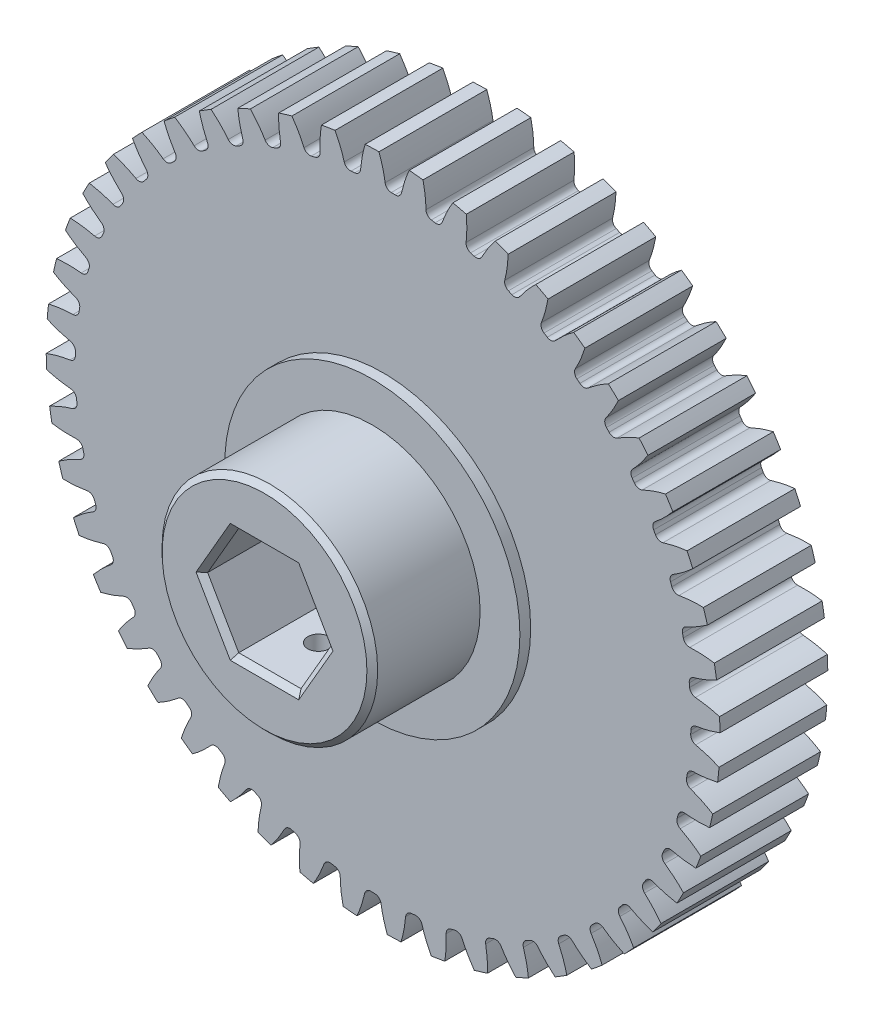
from build123d import *

# Parameters (mm, degrees)
SKETCH1_R                 = 39.6875
BOSS_EXTRUDE1_DEPTH       = 12.7
CUT_EXTRUDE1_DEPTH        = 58.545506449
FILLET1_R                 = 0.7480935
CIRPATTERN1_START         = -12.7
CIRPATTERN1_DEPTH         = 12.7
SKETCH6_R                 = 12.7
BOSS_EXTRUDE2_DEPTH       = 10.16
BOSS_EXTRUDE3_START       = 13.97
SKETCH7_R                 = 12.7
BOSS_EXTRUDE3_DEPTH       = 13.97
CUT_EXTRUDE3_DEPTH        = 12.7
M3X0_5_TAPPED_HOLE1_D     = 2.5
M3X0_5_TAPPED_HOLE1_DEPTH = 10.6700066
M3X0_5_TAPPED_HOLE1_TIP   = 0.751075774
CHAMFER1_SIZE             = 0.635
BOSS_EXTRUDE4_START       = 1.27
SKETCH11_R                = 17.3863
SKETCH11_R_2              = 12.7
BOSS_EXTRUDE4_DEPTH       = 1.27
SKETCH12_R                = 17.3863
SKETCH12_R_2              = 12.7
BOSS_EXTRUDE5_DEPTH       = 1.27
CUT_EXTRUDE4_DEPTH        = 12.7


# Read off the part's stored shape, not the designer's step: CirPattern1
with BuildPart() as part:
    # Sketch1 → Boss-Extrude1 (new body)
    with BuildSketch(Plane.XY):
        Circle(SKETCH1_R)
    extrude(amount=-BOSS_EXTRUDE1_DEPTH)

    # Sketch4 → Cut-Extrude1 (cut, through all)
    with BuildSketch(Plane.XY):
        with BuildLine():
            Line((0.240718922, 36.88563963), (0.240718922, 36.262463534))
            ThreePointArc((0.240718922, 36.262463534), (1.186503463, 36.243846604), (2.131480605, 36.20056626))
            Line((2.131480605, 36.20056626), (2.172238367, 36.822408083))
            add(Edge.make_bspline(
                [(6.893954828, 44.735686784), (3.179844428, 41.34985308), (2.172238367, 36.822408083)],
                knots=[0, 0, 0, 1, 1, 1], degree=2))
            ThreePointArc((6.893954828, 44.735686784), (1.480992288, 45.23952859), (-3.953333536, 45.090791068))
            add(Edge.make_bspline(
                [(-3.953333536, 45.090791068), (-0.468620005, 41.469291718), (0.240718922, 36.88563963)],
                knots=[0, 0, 0, 1, 1, 1], degree=2))
        make_face()
    extrude(amount=-CUT_EXTRUDE1_DEPTH, mode=Mode.SUBTRACT)

    # Fillet1
    # the kernel refuses this fillet: 0.7480935 mm, written as the material it adds along each edge
    with BuildSketch(Plane(origin=(2.131480605, 36.20056626, 0), x_dir=(-0.9988052902028769, 0.0488670877252457, 0), z_dir=(0, 0, -1))) as fillet1_piece_1:
        with BuildLine():
            CenterArc((0.727260644, 0.748056652), FILLET1_R, 189.616112264, 79.815209924)
            Line((-0.010321469, 0.623090615), (-0.025073112, 0.620591294))
            ThreePointArc((-0.025073112, 0.620591294), (-0.020120552, 0.311297499), (-0.014959818, -0.000247809))
            Line((-0.014959818, -0.000247809), (0.000148499, -0.014961133))
            ThreePointArc((0.000148499, -0.014961133), (0.359917857, -0.013175709), (0.719687215, -0.014961133))
            Line((0.719687215, -0.014961133), (0.719835714, 0))
        make_face()
    extrude(amount=12.7)
    with BuildSketch(Plane(origin=(0.240718922, 36.262463534, 0), x_dir=(0, 1, 0), z_dir=(0, 0, -1))) as fillet1_piece_2:
        with BuildLine():
            CenterArc((0.735908652, 0.739550712), FILLET1_R, 181.51769315, 79.815209924)
            Line((-0.011922412, 0.719736973), (-0.026879033, 0.719340698))
            ThreePointArc((-0.026879033, 0.719340698), (-0.019135108, 0.359650261), (-0.01496154, -9.9318e-05))
            Line((-0.01496154, -9.9318e-05), (0, -0.01496187))
            ThreePointArc((0, -0.01496187), (0.311588048, -0.01496187), (0.620921445, -0.014791014))
            Line((0.620921445, -0.014791014), (0.623176097, 0))
        make_face()
    extrude(amount=12.7)

    # CirPattern1 outline → CirPattern1 (cut)
    with BuildSketch(Plane.XY.offset(CIRPATTERN1_START)):
        with BuildLine():
            ThreePointArc((-2.112500539, 39.631237651), (-3.890052234, 39.496394138), (-5.65975547, 39.28186381))
            add(Edge.make_bspline(
                [(-5.65975547, 39.28186381), (-4.986888308, 38.00730371), (-4.57588255, 36.601497994)],
                knots=[0.684219953, 0.684219953, 0.684219953, 1, 1, 1], degree=2))
            ThreePointArc((-4.57588255, 36.601497994), (-4.274892959, 36.189054339), (-3.779406036, 36.065777368))
            ThreePointArc((-3.779406036, 36.065777368), (-3.554418528, 36.088645251), (-3.329292785, 36.110109619))
            ThreePointArc((-3.329292785, 36.110109619), (-2.867376615, 36.327682491), (-2.652634149, 36.79092128))
            add(Edge.make_bspline(
                [(-2.652634149, 36.79092128), (-2.523784618, 38.249898059), (-2.112500539, 39.631237651)],
                knots=[0, 0, 0, 0.315780047, 0.315780047, 0.315780047], degree=2))
        make_face()
        with BuildLine():
            add(Edge.make_bspline(
                [(6.959943282, 36.223853275), (7.462013348, 37.599767913), (8.216800257, 38.827591347)],
                knots=[0, 0, 0, 0.315780047, 0.315780047, 0.315780047], degree=2))
            ThreePointArc((8.216800257, 38.827591347), (6.464917097, 39.157406747), (4.699990502, 39.408219263))
            add(Edge.make_bspline(
                [(4.699990502, 39.408219263), (5.020049844, 38.002937911), (5.053201627, 36.538657746)],
                knots=[0.684219953, 0.684219953, 0.684219953, 1, 1, 1], degree=2))
            ThreePointArc((5.053201627, 36.538657746), (5.237186973, 36.062365929), (5.683884161, 35.815048066))
            ThreePointArc((5.683884161, 35.815048066), (5.90712405, 35.778905693), (6.130134206, 35.741371851))
            ThreePointArc((6.130134206, 35.741371851), (6.632622967, 35.831978404), (6.959943282, 36.223853275))
        make_face()
        with BuildLine():
            add(Edge.make_bspline(
                [(11.628561638, 35.005498294), (12.305929324, 36.304108497), (13.214522043, 37.422908271)],
                knots=[0, 0, 0, 0.315780047, 0.315780047, 0.315780047], degree=2))
            ThreePointArc((13.214522043, 37.422908271), (11.520676035, 37.978568692), (9.803586234, 38.45760462))
            add(Edge.make_bspline(
                [(9.803586234, 38.45760462), (9.9374814, 37.022569518), (9.779222651, 35.566489297)],
                knots=[0.684219953, 0.684219953, 0.684219953, 1, 1, 1], degree=2))
            ThreePointArc((9.779222651, 35.566489297), (9.89946542, 35.070257316), (10.310059592, 34.766749609))
            ThreePointArc((10.310059592, 34.766749609), (10.526672107, 34.701777786), (10.742875231, 34.635456384))
            ThreePointArc((10.742875231, 34.635456384), (11.25289166, 34.659699841), (11.628561638, 35.005498294))
        make_face()
        with BuildLine():
            add(Edge.make_bspline(
                [(16.09821208, 33.188189531), (16.939287436, 34.38727572), (17.986139693, 35.377908858)],
                knots=[0, 0, 0, 0.315780047, 0.315780047, 0.315780047], degree=2))
            ThreePointArc((17.986139693, 35.377908858), (16.379313011, 36.149906796), (14.739439888, 36.8489697))
            add(Edge.make_bspline(
                [(14.739439888, 36.8489697), (14.684879895, 35.408734696), (14.337918464, 33.985768355)],
                knots=[0.684219953, 0.684219953, 0.684219953, 1, 1, 1], degree=2))
            ThreePointArc((14.337918464, 33.985768355), (14.392361268, 33.478086876), (14.759827045, 33.123582426))
            ThreePointArc((14.759827045, 33.123582426), (14.966105885, 33.03089284), (15.171802681, 32.936918656))
            ThreePointArc((15.171802681, 32.936918656), (15.680620254, 32.894384205), (16.09821208, 33.188189531))
        make_face()
        with BuildLine():
            add(Edge.make_bspline(
                [(20.29241765, 30.803021645), (21.282809645, 31.882067121), (22.450009507, 32.727583617)],
                knots=[0, 0, 0, 0.315780047, 0.315780047, 0.315780047], degree=2))
            ThreePointArc((22.450009507, 32.727583617), (20.9576954, 33.702709973), (19.423097638, 34.609838691))
            add(Edge.make_bspline(
                [(19.423097638, 34.609838691), (19.181016023, 33.189046607), (18.651288517, 31.823541494)],
                knots=[0.684219953, 0.684219953, 0.684219953, 1, 1, 1], degree=2))
            ThreePointArc((18.651288517, 31.823541494), (18.638999825, 31.313097089), (18.957049766, 30.913661565))
            ThreePointArc((18.957049766, 30.913661565), (19.149465443, 30.794840159), (19.341136382, 30.674821118))
            ThreePointArc((19.341136382, 30.674821118), (19.84004909, 30.566236534), (20.29241765, 30.803021645))
        make_face()
        with BuildLine():
            add(Edge.make_bspline(
                [(24.139414328, 27.890805518), (25.262177079, 28.831347515), (26.529753433, 29.517280346)],
                knots=[0, 0, 0, 0.315780047, 0.315780047, 0.315780047], degree=2))
            ThreePointArc((26.529753433, 29.517280346), (25.177485811, 30.678850439), (23.774420802, 31.778523747))
            add(Edge.make_bspline(
                [(23.774420802, 31.778523747), (23.348959648, 30.401484728), (22.645529852, 29.116805014)],
                knots=[0.684219953, 0.684219953, 0.684219953, 1, 1, 1], degree=2))
            ThreePointArc((22.645529852, 29.116805014), (22.566719928, 28.612331528), (22.829912108, 28.174799383))
            ThreePointArc((22.829912108, 28.174799383), (23.005172337, 28.031879225), (23.179537876, 27.887868886))
            ThreePointArc((23.179537876, 27.887868886), (23.660009185, 27.715092082), (24.139414328, 27.890805518))
        make_face()
        with BuildLine():
            add(Edge.make_bspline(
                [(27.573378934, 24.501369976), (28.80930166, 25.287315559), (30.155565923, 25.801928224)],
                knots=[0, 0, 0, 0.315780047, 0.315780047, 0.315780047], degree=2))
            ThreePointArc((30.155565923, 25.801928224), (28.966482459, 27.130067267), (27.718957035, 28.403469451))
            add(Edge.make_bspline(
                [(27.718957035, 28.403469451), (27.117396101, 27.093745016), (26.252299893, 25.911871929)],
                knots=[0.684219953, 0.684219953, 0.684219953, 1, 1, 1], degree=2))
            ThreePointArc((26.252299893, 25.911871929), (26.108317195, 25.422001043), (26.312148326, 24.953858572))
            ThreePointArc((26.312148326, 24.953858572), (26.467254355, 24.789285066), (26.621331051, 24.623747485))
            ThreePointArc((26.621331051, 24.623747485), (27.075139963, 24.389734721), (27.573378934, 24.501369976))
        make_face()
        with BuildLine():
            add(Edge.make_bspline(
                [(30.535555382, 20.6927092), (31.863491102, 21.310610622), (33.26540832, 21.645097957)],
                knots=[0, 0, 0, 0.315780047, 0.315780047, 0.315780047], degree=2))
            ThreePointArc((33.26540832, 21.645097957), (32.25985456, 23.117081123), (31.189214228, 24.542423918))
            add(Edge.make_bspline(
                [(31.189214228, 24.542423918), (30.421846388, 23.322423816), (29.409885805, 22.26357953)],
                knots=[0.684219953, 0.684219953, 0.684219953, 1, 1, 1], degree=2))
            ThreePointArc((29.409885805, 22.26357953), (29.203193917, 21.796693071), (29.34417639, 21.305950323))
            ThreePointArc((29.34417639, 21.305950323), (29.476474312, 21.122539366), (29.607625871, 20.938306938))
            ThreePointArc((29.607625871, 20.938306938), (30.02700759, 20.647062236), (30.535555382, 20.6927092))
        make_face()
        with BuildLine():
            add(Edge.make_bspline(
                [(32.975260012, 16.529990433), (34.372487377, 16.96927523), (35.806070357, 17.117914063)],
                knots=[0, 0, 0, 0.315780047, 0.315780047, 0.315780047], degree=2))
            ThreePointArc((35.806070357, 17.117914063), (35.001251607, 18.708555312), (34.125815318, 20.261450707))
            add(Edge.make_bspline(
                [(34.125815318, 20.261450707), (33.205770449, 19.152049477), (32.064260416, 18.234351113)],
                knots=[0.684219953, 0.684219953, 0.684219953, 1, 1, 1], degree=2))
            ThreePointArc((32.064260416, 18.234351113), (31.798395894, 17.798437637), (31.87411746, 17.293491356))
            ThreePointArc((31.87411746, 17.293491356), (31.981343622, 17.094381162), (32.087326004, 16.894606154))
            ThreePointArc((32.087326004, 16.894606154), (32.465104792, 16.551112792), (32.975260012, 16.529990433))
        make_face()
        with BuildLine():
            add(Edge.make_bspline(
                [(34.8507488, 12.084438946), (36.293360863, 12.337590834), (37.734080602, 12.297837913)],
                knots=[0, 0, 0, 0.315780047, 0.315780047, 0.315780047], degree=2))
            ThreePointArc((37.734080602, 12.297837913), (37.143767534, 13.979920933), (36.478514247, 15.633798458))
            add(Edge.make_bspline(
                [(36.478514247, 15.633798458), (35.421534571, 14.653978263), (34.170006641, 13.893127893)],
                knots=[0.684219953, 0.684219953, 0.684219953, 1, 1, 1], degree=2))
            ThreePointArc((34.170006641, 13.893127893), (33.849518502, 13.495646001), (33.858683544, 12.985135958))
            ThreePointArc((33.858683544, 12.985135958), (33.939003275, 12.773733356), (34.018003092, 12.561833974))
            ThreePointArc((34.018003092, 12.561833974), (34.34771505, 12.171969219), (34.8507488, 12.084438946))
        make_face()
        with BuildLine():
            add(Edge.make_bspline(
                [(36.129931613, 7.432119359), (37.593244882, 7.494806837), (39.016450267, 7.267342347)],
                knots=[0, 0, 0, 0.315780047, 0.315780047, 0.315780047], degree=2))
            ThreePointArc((39.016450267, 7.267342347), (38.6507433, 9.01208623), (38.207055683, 10.738647582))
            add(Edge.make_bspline(
                [(38.207055683, 10.738647582), (37.031226416, 9.905173417), (35.69109458, 9.314189403)],
                knots=[0.684219953, 0.684219953, 0.684219953, 1, 1, 1], degree=2))
            ThreePointArc((35.69109458, 9.314189403), (35.321466463, 8.96194012), (35.263918164, 8.454601283))
            ThreePointArc((35.263918164, 8.454601283), (35.315957172, 8.234523431), (35.366622715, 8.014125333))
            ThreePointArc((35.366622715, 8.014125333), (35.642626379, 7.584559878), (36.129931613, 7.432119359))
        make_face()
        with BuildLine():
            add(Edge.make_bspline(
                [(36.79092128, 2.652634149), (38.249898059, 2.523784618), (39.631237651, 2.112500539)],
                knots=[0, 0, 0, 0.315780047, 0.315780047, 0.315780047], degree=2))
            ThreePointArc((39.631237651, 2.112500539), (39.496394132, 3.890052234), (39.281863803, 5.659755469))
            add(Edge.make_bspline(
                [(39.281863803, 5.659755469), (38.00730371, 4.986888308), (36.601497994, 4.57588255)],
                knots=[0.684219953, 0.684219953, 0.684219953, 1, 1, 1], degree=2))
            ThreePointArc((36.601497994, 4.57588255), (36.189054339, 4.274892959), (36.065777368, 3.779406036))
            ThreePointArc((36.065777368, 3.779406036), (36.088645251, 3.554418528), (36.110109619, 3.329292785))
            ThreePointArc((36.110109619, 3.329292785), (36.327682491, 2.867376615), (36.79092128, 2.652634149))
        make_face()
        with BuildLine():
            add(Edge.make_bspline(
                [(36.822408083, -2.172238367), (38.252084875, -2.490420255), (39.56792357, -3.07848674)],
                knots=[0, 0, 0, 0.315780047, 0.315780047, 0.315780047], degree=2))
            ThreePointArc((39.56792357, -3.07848674), (39.666250711, -1.298541635), (39.684548343, 0.484023371))
            add(Edge.make_bspline(
                [(39.684548343, 0.484023371), (38.3330655, -0.016723843), (36.88563963, -0.240718922)],
                knots=[0.684219953, 0.684219953, 0.684219953, 1, 1, 1], degree=2))
            ThreePointArc((36.88563963, -0.240718922), (36.437437463, -0.485298806), (36.250541122, -0.960455895))
            ThreePointArc((36.250541122, -0.960455895), (36.243846604, -1.186503463), (36.235742535, -1.412504886))
            ThreePointArc((36.235742535, -1.412504886), (36.391161882, -1.898868257), (36.822408083, -2.172238367))
        make_face()
        with BuildLine():
            add(Edge.make_bspline(
                [(36.223853275, -6.959943282), (37.599767913, -7.462013348), (38.827591347, -8.216800257)],
                knots=[0, 0, 0, 0.315780047, 0.315780047, 0.315780047], degree=2))
            ThreePointArc((38.827591347, -8.216800257), (39.157406742, -6.464917096), (39.408219258, -4.699990501))
            add(Edge.make_bspline(
                [(39.408219258, -4.699990501), (38.002937911, -5.020049844), (36.538657746, -5.053201627)],
                knots=[0.684219953, 0.684219953, 0.684219953, 1, 1, 1], degree=2))
            ThreePointArc((36.538657746, -5.053201627), (36.062365929, -5.237186973), (35.815048066, -5.683884161))
            ThreePointArc((35.815048066, -5.683884161), (35.778905693, -5.90712405), (35.741371851, -6.130134206))
            ThreePointArc((35.741371851, -6.130134206), (35.831978404, -6.632622967), (36.223853275, -6.959943282))
        make_face()
        with BuildLine():
            add(Edge.make_bspline(
                [(35.005498294, -11.628561638), (36.304108497, -12.305929324), (37.422908271, -13.214522043)],
                knots=[0, 0, 0, 0.315780047, 0.315780047, 0.315780047], degree=2))
            ThreePointArc((37.422908271, -13.214522043), (37.978568688, -11.520676033), (38.457604616, -9.803586233))
            add(Edge.make_bspline(
                [(38.457604616, -9.803586233), (37.022569518, -9.9374814), (35.566489297, -9.779222651)],
                knots=[0.684219953, 0.684219953, 0.684219953, 1, 1, 1], degree=2))
            ThreePointArc((35.566489297, -9.779222651), (35.070257316, -9.89946542), (34.766749609, -10.310059592))
            ThreePointArc((34.766749609, -10.310059592), (34.701777786, -10.526672107), (34.635456384, -10.742875231))
            ThreePointArc((34.635456384, -10.742875231), (34.659699841, -11.25289166), (35.005498294, -11.628561638))
        make_face()
        with BuildLine():
            add(Edge.make_bspline(
                [(33.188189531, -16.09821208), (34.38727572, -16.939287436), (35.377908858, -17.986139693)],
                knots=[0, 0, 0, 0.315780047, 0.315780047, 0.315780047], degree=2))
            ThreePointArc((35.377908858, -17.986139693), (36.149906794, -16.37931301), (36.848969696, -14.739439886))
            add(Edge.make_bspline(
                [(36.848969696, -14.739439886), (35.408734696, -14.684879895), (33.985768355, -14.337918464)],
                knots=[0.684219953, 0.684219953, 0.684219953, 1, 1, 1], degree=2))
            ThreePointArc((33.985768355, -14.337918464), (33.478086876, -14.392361268), (33.123582426, -14.759827045))
            ThreePointArc((33.123582426, -14.759827045), (33.03089284, -14.966105885), (32.936918656, -15.171802681))
            ThreePointArc((32.936918656, -15.171802681), (32.894384205, -15.680620254), (33.188189531, -16.09821208))
        make_face()
        with BuildLine():
            add(Edge.make_bspline(
                [(30.803021645, -20.29241765), (31.882067121, -21.282809645), (32.727583617, -22.450009507)],
                knots=[0, 0, 0, 0.315780047, 0.315780047, 0.315780047], degree=2))
            ThreePointArc((32.727583617, -22.450009507), (33.702709972, -20.957695399), (34.609838689, -19.423097637))
            add(Edge.make_bspline(
                [(34.609838689, -19.423097637), (33.189046607, -19.181016023), (31.823541494, -18.651288517)],
                knots=[0.684219953, 0.684219953, 0.684219953, 1, 1, 1], degree=2))
            ThreePointArc((31.823541494, -18.651288517), (31.313097089, -18.638999825), (30.913661565, -18.957049766))
            ThreePointArc((30.913661565, -18.957049766), (30.794840159, -19.149465443), (30.674821118, -19.341136382))
            ThreePointArc((30.674821118, -19.341136382), (30.566236534, -19.84004909), (30.803021645, -20.29241765))
        make_face()
        with BuildLine():
            add(Edge.make_bspline(
                [(27.890805518, -24.139414328), (28.831347515, -25.262177079), (29.517280346, -26.529753433)],
                knots=[0, 0, 0, 0.315780047, 0.315780047, 0.315780047], degree=2))
            ThreePointArc((29.517280346, -26.529753433), (30.678850438, -25.17748581), (31.778523746, -23.774420801))
            add(Edge.make_bspline(
                [(31.778523746, -23.774420801), (30.401484728, -23.348959648), (29.116805014, -22.645529852)],
                knots=[0.684219953, 0.684219953, 0.684219953, 1, 1, 1], degree=2))
            ThreePointArc((29.116805014, -22.645529852), (28.612331528, -22.566719928), (28.174799383, -22.829912108))
            ThreePointArc((28.174799383, -22.829912108), (28.031879225, -23.005172337), (27.887868886, -23.179537876))
            ThreePointArc((27.887868886, -23.179537876), (27.715092082, -23.660009185), (27.890805518, -24.139414328))
        make_face()
        with BuildLine():
            add(Edge.make_bspline(
                [(24.501369976, -27.573378934), (25.287315559, -28.80930166), (25.801928224, -30.155565923)],
                knots=[0, 0, 0, 0.315780047, 0.315780047, 0.315780047], degree=2))
            ThreePointArc((25.801928224, -30.155565923), (27.130067267, -28.966482459), (28.403469451, -27.718957035))
            add(Edge.make_bspline(
                [(28.403469451, -27.718957035), (27.093745016, -27.117396101), (25.911871929, -26.252299893)],
                knots=[0.684219953, 0.684219953, 0.684219953, 1, 1, 1], degree=2))
            ThreePointArc((25.911871929, -26.252299893), (25.422001043, -26.108317195), (24.953858572, -26.312148326))
            ThreePointArc((24.953858572, -26.312148326), (24.789285066, -26.467254355), (24.623747485, -26.621331051))
            ThreePointArc((24.623747485, -26.621331051), (24.389734721, -27.075139963), (24.501369976, -27.573378934))
        make_face()
        with BuildLine():
            add(Edge.make_bspline(
                [(20.6927092, -30.535555382), (21.310610622, -31.863491102), (21.645097957, -33.26540832)],
                knots=[0, 0, 0, 0.315780047, 0.315780047, 0.315780047], degree=2))
            ThreePointArc((21.645097957, -33.26540832), (23.117081124, -32.259854561), (24.542423918, -31.189214229))
            add(Edge.make_bspline(
                [(24.542423918, -31.189214229), (23.322423816, -30.421846388), (22.26357953, -29.409885805)],
                knots=[0.684219953, 0.684219953, 0.684219953, 1, 1, 1], degree=2))
            ThreePointArc((22.26357953, -29.409885805), (21.796693071, -29.203193917), (21.305950323, -29.34417639))
            ThreePointArc((21.305950323, -29.34417639), (21.122539366, -29.476474312), (20.938306938, -29.607625871))
            ThreePointArc((20.938306938, -29.607625871), (20.647062236, -30.02700759), (20.6927092, -30.535555382))
        make_face()
        with BuildLine():
            add(Edge.make_bspline(
                [(16.529990433, -32.975260012), (16.96927523, -34.372487377), (17.117914063, -35.806070357)],
                knots=[0, 0, 0, 0.315780047, 0.315780047, 0.315780047], degree=2))
            ThreePointArc((17.117914063, -35.806070357), (18.708555313, -35.001251608), (20.261450708, -34.12581532))
            add(Edge.make_bspline(
                [(20.261450708, -34.12581532), (19.152049477, -33.205770449), (18.234351113, -32.064260416)],
                knots=[0.684219953, 0.684219953, 0.684219953, 1, 1, 1], degree=2))
            ThreePointArc((18.234351113, -32.064260416), (17.798437637, -31.798395894), (17.293491356, -31.87411746))
            ThreePointArc((17.293491356, -31.87411746), (17.094381162, -31.981343622), (16.894606154, -32.087326004))
            ThreePointArc((16.894606154, -32.087326004), (16.551112792, -32.465104792), (16.529990433, -32.975260012))
        make_face()
        with BuildLine():
            add(Edge.make_bspline(
                [(12.084438946, -34.8507488), (12.337590834, -36.293360863), (12.297837913, -37.734080602)],
                knots=[0, 0, 0, 0.315780047, 0.315780047, 0.315780047], degree=2))
            ThreePointArc((12.297837913, -37.734080602), (13.979920934, -37.143767536), (15.633798459, -36.478514249))
            add(Edge.make_bspline(
                [(15.633798459, -36.478514249), (14.653978263, -35.421534571), (13.893127893, -34.170006641)],
                knots=[0.684219953, 0.684219953, 0.684219953, 1, 1, 1], degree=2))
            ThreePointArc((13.893127893, -34.170006641), (13.495646001, -33.849518502), (12.985135958, -33.858683544))
            ThreePointArc((12.985135958, -33.858683544), (12.773733356, -33.939003275), (12.561833974, -34.018003092))
            ThreePointArc((12.561833974, -34.018003092), (12.171969219, -34.34771505), (12.084438946, -34.8507488))
        make_face()
        with BuildLine():
            add(Edge.make_bspline(
                [(7.432119359, -36.129931613), (7.494806837, -37.593244882), (7.267342347, -39.016450267)],
                knots=[0, 0, 0, 0.315780047, 0.315780047, 0.315780047], degree=2))
            ThreePointArc((7.267342347, -39.016450267), (9.012086231, -38.650743303), (10.738647583, -38.207055686))
            add(Edge.make_bspline(
                [(10.738647583, -38.207055686), (9.905173417, -37.031226416), (9.314189403, -35.69109458)],
                knots=[0.684219953, 0.684219953, 0.684219953, 1, 1, 1], degree=2))
            ThreePointArc((9.314189403, -35.69109458), (8.96194012, -35.321466463), (8.454601283, -35.263918164))
            ThreePointArc((8.454601283, -35.263918164), (8.234523431, -35.315957172), (8.014125333, -35.366622715))
            ThreePointArc((8.014125333, -35.366622715), (7.584559878, -35.642626379), (7.432119359, -36.129931613))
        make_face()
        with BuildLine():
            add(Edge.make_bspline(
                [(2.652634149, -36.79092128), (2.523784618, -38.249898059), (2.112500539, -39.631237651)],
                knots=[0, 0, 0, 0.315780047, 0.315780047, 0.315780047], degree=2))
            ThreePointArc((2.112500539, -39.631237651), (3.890052234, -39.496394137), (5.65975547, -39.281863808))
            add(Edge.make_bspline(
                [(5.65975547, -39.281863808), (4.986888308, -38.00730371), (4.57588255, -36.601497994)],
                knots=[0.684219953, 0.684219953, 0.684219953, 1, 1, 1], degree=2))
            ThreePointArc((4.57588255, -36.601497994), (4.274892959, -36.189054339), (3.779406036, -36.065777368))
            ThreePointArc((3.779406036, -36.065777368), (3.554418528, -36.088645251), (3.329292785, -36.110109619))
            ThreePointArc((3.329292785, -36.110109619), (2.867376615, -36.327682491), (2.652634149, -36.79092128))
        make_face()
        with BuildLine():
            add(Edge.make_bspline(
                [(-2.172238367, -36.822408083), (-2.490420255, -38.252084875), (-3.07848674, -39.56792357)],
                knots=[0, 0, 0, 0.315780047, 0.315780047, 0.315780047], degree=2))
            ThreePointArc((-3.07848674, -39.56792357), (-1.298541635, -39.666250716), (0.484023371, -39.684548348))
            add(Edge.make_bspline(
                [(0.484023371, -39.684548348), (-0.016723843, -38.3330655), (-0.240718922, -36.88563963)],
                knots=[0.684219953, 0.684219953, 0.684219953, 1, 1, 1], degree=2))
            ThreePointArc((-0.240718922, -36.88563963), (-0.485298806, -36.437437463), (-0.960455895, -36.250541122))
            ThreePointArc((-0.960455895, -36.250541122), (-1.186503463, -36.243846604), (-1.412504886, -36.235742535))
            ThreePointArc((-1.412504886, -36.235742535), (-1.898868257, -36.391161882), (-2.172238367, -36.822408083))
        make_face()
        with BuildLine():
            add(Edge.make_bspline(
                [(-6.959943282, -36.223853275), (-7.462013348, -37.599767913), (-8.216800257, -38.827591347)],
                knots=[0, 0, 0, 0.315780047, 0.315780047, 0.315780047], degree=2))
            ThreePointArc((-8.216800257, -38.827591347), (-6.464917097, -39.157406748), (-4.699990502, -39.408219264))
            add(Edge.make_bspline(
                [(-4.699990502, -39.408219264), (-5.020049844, -38.002937911), (-5.053201627, -36.538657746)],
                knots=[0.684219953, 0.684219953, 0.684219953, 1, 1, 1], degree=2))
            ThreePointArc((-5.053201627, -36.538657746), (-5.237186973, -36.062365929), (-5.683884161, -35.815048066))
            ThreePointArc((-5.683884161, -35.815048066), (-5.90712405, -35.778905693), (-6.130134206, -35.741371851))
            ThreePointArc((-6.130134206, -35.741371851), (-6.632622967, -35.831978404), (-6.959943282, -36.223853275))
        make_face()
        with BuildLine():
            add(Edge.make_bspline(
                [(-11.628561638, -35.005498294), (-12.305929324, -36.304108497), (-13.214522043, -37.422908271)],
                knots=[0, 0, 0, 0.315780047, 0.315780047, 0.315780047], degree=2))
            ThreePointArc((-13.214522043, -37.422908271), (-11.520676035, -37.978568694), (-9.803586235, -38.457604622))
            add(Edge.make_bspline(
                [(-9.803586235, -38.457604622), (-9.9374814, -37.022569518), (-9.779222651, -35.566489297)],
                knots=[0.684219953, 0.684219953, 0.684219953, 1, 1, 1], degree=2))
            ThreePointArc((-9.779222651, -35.566489297), (-9.89946542, -35.070257316), (-10.310059592, -34.766749609))
            ThreePointArc((-10.310059592, -34.766749609), (-10.526672107, -34.701777786), (-10.742875231, -34.635456384))
            ThreePointArc((-10.742875231, -34.635456384), (-11.25289166, -34.659699841), (-11.628561638, -35.005498294))
        make_face()
        with BuildLine():
            add(Edge.make_bspline(
                [(-16.09821208, -33.188189531), (-16.939287436, -34.38727572), (-17.986139693, -35.377908858)],
                knots=[0, 0, 0, 0.315780047, 0.315780047, 0.315780047], degree=2))
            ThreePointArc((-17.986139693, -35.377908858), (-16.379313013, -36.1499068), (-14.739439889, -36.848969703))
            add(Edge.make_bspline(
                [(-14.739439889, -36.848969703), (-14.684879895, -35.408734696), (-14.337918464, -33.985768355)],
                knots=[0.684219953, 0.684219953, 0.684219953, 1, 1, 1], degree=2))
            ThreePointArc((-14.337918464, -33.985768355), (-14.392361268, -33.478086876), (-14.759827045, -33.123582426))
            ThreePointArc((-14.759827045, -33.123582426), (-14.966105885, -33.03089284), (-15.171802681, -32.936918656))
            ThreePointArc((-15.171802681, -32.936918656), (-15.680620254, -32.894384205), (-16.09821208, -33.188189531))
        make_face()
        with BuildLine():
            add(Edge.make_bspline(
                [(-20.29241765, -30.803021645), (-21.282809645, -31.882067121), (-22.450009507, -32.727583617)],
                knots=[0, 0, 0, 0.315780047, 0.315780047, 0.315780047], degree=2))
            ThreePointArc((-22.450009507, -32.727583617), (-20.957695403, -33.702709978), (-19.42309764, -34.609838695))
            add(Edge.make_bspline(
                [(-19.42309764, -34.609838695), (-19.181016023, -33.189046607), (-18.651288517, -31.823541494)],
                knots=[0.684219953, 0.684219953, 0.684219953, 1, 1, 1], degree=2))
            ThreePointArc((-18.651288517, -31.823541494), (-18.638999825, -31.313097089), (-18.957049766, -30.913661565))
            ThreePointArc((-18.957049766, -30.913661565), (-19.149465443, -30.794840159), (-19.341136382, -30.674821118))
            ThreePointArc((-19.341136382, -30.674821118), (-19.84004909, -30.566236534), (-20.29241765, -30.803021645))
        make_face()
        with BuildLine():
            add(Edge.make_bspline(
                [(-24.139414328, -27.890805518), (-25.262177079, -28.831347515), (-26.529753433, -29.517280346)],
                knots=[0, 0, 0, 0.315780047, 0.315780047, 0.315780047], degree=2))
            ThreePointArc((-26.529753433, -29.517280346), (-25.177485815, -30.678850444), (-23.774420806, -31.778523752))
            add(Edge.make_bspline(
                [(-23.774420806, -31.778523752), (-23.348959648, -30.401484728), (-22.645529852, -29.116805014)],
                knots=[0.684219953, 0.684219953, 0.684219953, 1, 1, 1], degree=2))
            ThreePointArc((-22.645529852, -29.116805014), (-22.566719928, -28.612331528), (-22.829912108, -28.174799383))
            ThreePointArc((-22.829912108, -28.174799383), (-23.005172337, -28.031879225), (-23.179537876, -27.887868886))
            ThreePointArc((-23.179537876, -27.887868886), (-23.660009185, -27.715092082), (-24.139414328, -27.890805518))
        make_face()
        with BuildLine():
            add(Edge.make_bspline(
                [(-27.573378934, -24.501369976), (-28.80930166, -25.287315559), (-30.155565923, -25.801928224)],
                knots=[0, 0, 0, 0.315780047, 0.315780047, 0.315780047], degree=2))
            ThreePointArc((-30.155565923, -25.801928224), (-28.966482464, -27.130067272), (-27.71895704, -28.403469456))
            add(Edge.make_bspline(
                [(-27.71895704, -28.403469456), (-27.117396101, -27.093745016), (-26.252299893, -25.911871929)],
                knots=[0.684219953, 0.684219953, 0.684219953, 1, 1, 1], degree=2))
            ThreePointArc((-26.252299893, -25.911871929), (-26.108317195, -25.422001043), (-26.312148326, -24.953858572))
            ThreePointArc((-26.312148326, -24.953858572), (-26.467254355, -24.789285066), (-26.621331051, -24.623747485))
            ThreePointArc((-26.621331051, -24.623747485), (-27.075139963, -24.389734721), (-27.573378934, -24.501369976))
        make_face()
        with BuildLine():
            add(Edge.make_bspline(
                [(-30.535555382, -20.6927092), (-31.863491102, -21.310610622), (-33.26540832, -21.645097957)],
                knots=[0, 0, 0, 0.315780047, 0.315780047, 0.315780047], degree=2))
            ThreePointArc((-33.26540832, -21.645097957), (-32.259854567, -23.117081128), (-31.189214234, -24.542423923))
            add(Edge.make_bspline(
                [(-31.189214234, -24.542423923), (-30.421846388, -23.322423816), (-29.409885805, -22.26357953)],
                knots=[0.684219953, 0.684219953, 0.684219953, 1, 1, 1], degree=2))
            ThreePointArc((-29.409885805, -22.26357953), (-29.203193917, -21.796693071), (-29.34417639, -21.305950323))
            ThreePointArc((-29.34417639, -21.305950323), (-29.476474312, -21.122539366), (-29.607625871, -20.938306938))
            ThreePointArc((-29.607625871, -20.938306938), (-30.02700759, -20.647062236), (-30.535555382, -20.6927092))
        make_face()
        with BuildLine():
            add(Edge.make_bspline(
                [(-32.975260012, -16.529990433), (-34.372487377, -16.96927523), (-35.806070357, -17.117914063)],
                knots=[0, 0, 0, 0.315780047, 0.315780047, 0.315780047], degree=2))
            ThreePointArc((-35.806070357, -17.117914063), (-35.001251615, -18.708555316), (-34.125815326, -20.261450712))
            add(Edge.make_bspline(
                [(-34.125815326, -20.261450712), (-33.205770449, -19.152049477), (-32.064260416, -18.234351113)],
                knots=[0.684219953, 0.684219953, 0.684219953, 1, 1, 1], degree=2))
            ThreePointArc((-32.064260416, -18.234351113), (-31.798395894, -17.798437637), (-31.87411746, -17.293491356))
            ThreePointArc((-31.87411746, -17.293491356), (-31.981343622, -17.094381162), (-32.087326004, -16.894606154))
            ThreePointArc((-32.087326004, -16.894606154), (-32.465104792, -16.551112792), (-32.975260012, -16.529990433))
        make_face()
        with BuildLine():
            add(Edge.make_bspline(
                [(-34.8507488, -12.084438946), (-36.293360863, -12.337590834), (-37.734080602, -12.297837913)],
                knots=[0, 0, 0, 0.315780047, 0.315780047, 0.315780047], degree=2))
            ThreePointArc((-37.734080602, -12.297837913), (-37.143767543, -13.979920936), (-36.478514256, -15.633798461))
            add(Edge.make_bspline(
                [(-36.478514256, -15.633798461), (-35.421534571, -14.653978263), (-34.170006641, -13.893127893)],
                knots=[0.684219953, 0.684219953, 0.684219953, 1, 1, 1], degree=2))
            ThreePointArc((-34.170006641, -13.893127893), (-33.849518502, -13.495646001), (-33.858683544, -12.985135958))
            ThreePointArc((-33.858683544, -12.985135958), (-33.939003275, -12.773733356), (-34.018003092, -12.561833974))
            ThreePointArc((-34.018003092, -12.561833974), (-34.34771505, -12.171969219), (-34.8507488, -12.084438946))
        make_face()
        with BuildLine():
            add(Edge.make_bspline(
                [(-36.129931613, -7.432119359), (-37.593244882, -7.494806837), (-39.016450267, -7.267342347)],
                knots=[0, 0, 0, 0.315780047, 0.315780047, 0.315780047], degree=2))
            ThreePointArc((-39.016450267, -7.267342347), (-38.65074331, -9.012086233), (-38.207055693, -10.738647585))
            add(Edge.make_bspline(
                [(-38.207055693, -10.738647585), (-37.031226416, -9.905173417), (-35.69109458, -9.314189403)],
                knots=[0.684219953, 0.684219953, 0.684219953, 1, 1, 1], degree=2))
            ThreePointArc((-35.69109458, -9.314189403), (-35.321466463, -8.96194012), (-35.263918164, -8.454601283))
            ThreePointArc((-35.263918164, -8.454601283), (-35.315957172, -8.234523431), (-35.366622715, -8.014125333))
            ThreePointArc((-35.366622715, -8.014125333), (-35.642626379, -7.584559878), (-36.129931613, -7.432119359))
        make_face()
        with BuildLine():
            add(Edge.make_bspline(
                [(-36.79092128, -2.652634149), (-38.249898059, -2.523784618), (-39.631237651, -2.112500539)],
                knots=[0, 0, 0, 0.315780047, 0.315780047, 0.315780047], degree=2))
            ThreePointArc((-39.631237651, -2.112500539), (-39.496394143, -3.890052235), (-39.281863814, -5.659755471))
            add(Edge.make_bspline(
                [(-39.281863814, -5.659755471), (-38.00730371, -4.986888308), (-36.601497994, -4.57588255)],
                knots=[0.684219953, 0.684219953, 0.684219953, 1, 1, 1], degree=2))
            ThreePointArc((-36.601497994, -4.57588255), (-36.189054339, -4.274892959), (-36.065777368, -3.779406036))
            ThreePointArc((-36.065777368, -3.779406036), (-36.088645251, -3.554418528), (-36.110109619, -3.329292785))
            ThreePointArc((-36.110109619, -3.329292785), (-36.327682491, -2.867376615), (-36.79092128, -2.652634149))
        make_face()
        with BuildLine():
            add(Edge.make_bspline(
                [(-36.822408083, 2.172238367), (-38.252084875, 2.490420255), (-39.56792357, 3.07848674)],
                knots=[0, 0, 0, 0.315780047, 0.315780047, 0.315780047], degree=2))
            ThreePointArc((-39.56792357, 3.07848674), (-39.666250722, 1.298541635), (-39.684548354, -0.484023371))
            add(Edge.make_bspline(
                [(-39.684548354, -0.484023371), (-38.3330655, 0.016723843), (-36.88563963, 0.240718922)],
                knots=[0.684219953, 0.684219953, 0.684219953, 1, 1, 1], degree=2))
            ThreePointArc((-36.88563963, 0.240718922), (-36.437437463, 0.485298806), (-36.250541122, 0.960455895))
            ThreePointArc((-36.250541122, 0.960455895), (-36.243846604, 1.186503463), (-36.235742535, 1.412504886))
            ThreePointArc((-36.235742535, 1.412504886), (-36.391161882, 1.898868257), (-36.822408083, 2.172238367))
        make_face()
        with BuildLine():
            add(Edge.make_bspline(
                [(-36.223853275, 6.959943282), (-37.599767913, 7.462013348), (-38.827591347, 8.216800257)],
                knots=[0, 0, 0, 0.315780047, 0.315780047, 0.315780047], degree=2))
            ThreePointArc((-38.827591347, 8.216800257), (-39.157406753, 6.464917098), (-39.408219269, 4.699990503))
            add(Edge.make_bspline(
                [(-39.408219269, 4.699990503), (-38.002937911, 5.020049844), (-36.538657746, 5.053201627)],
                knots=[0.684219953, 0.684219953, 0.684219953, 1, 1, 1], degree=2))
            ThreePointArc((-36.538657746, 5.053201627), (-36.062365929, 5.237186973), (-35.815048066, 5.683884161))
            ThreePointArc((-35.815048066, 5.683884161), (-35.778905693, 5.90712405), (-35.741371851, 6.130134206))
            ThreePointArc((-35.741371851, 6.130134206), (-35.831978404, 6.632622967), (-36.223853275, 6.959943282))
        make_face()
        with BuildLine():
            add(Edge.make_bspline(
                [(-35.005498294, 11.628561638), (-36.304108497, 12.305929324), (-37.422908271, 13.214522043)],
                knots=[0, 0, 0, 0.315780047, 0.315780047, 0.315780047], degree=2))
            ThreePointArc((-37.422908271, 13.214522043), (-37.978568698, 11.520676036), (-38.457604626, 9.803586236))
            add(Edge.make_bspline(
                [(-38.457604626, 9.803586236), (-37.022569518, 9.9374814), (-35.566489297, 9.779222651)],
                knots=[0.684219953, 0.684219953, 0.684219953, 1, 1, 1], degree=2))
            ThreePointArc((-35.566489297, 9.779222651), (-35.070257316, 9.89946542), (-34.766749609, 10.310059592))
            ThreePointArc((-34.766749609, 10.310059592), (-34.701777786, 10.526672107), (-34.635456384, 10.742875231))
            ThreePointArc((-34.635456384, 10.742875231), (-34.659699841, 11.25289166), (-35.005498294, 11.628561638))
        make_face()
        with BuildLine():
            add(Edge.make_bspline(
                [(-33.188189531, 16.09821208), (-34.38727572, 16.939287436), (-35.377908858, 17.986139693)],
                knots=[0, 0, 0, 0.315780047, 0.315780047, 0.315780047], degree=2))
            ThreePointArc((-35.377908858, 17.986139693), (-36.149906803, 16.379313014), (-36.848969706, 14.73943989))
            add(Edge.make_bspline(
                [(-36.848969706, 14.73943989), (-35.408734696, 14.684879895), (-33.985768355, 14.337918464)],
                knots=[0.684219953, 0.684219953, 0.684219953, 1, 1, 1], degree=2))
            ThreePointArc((-33.985768355, 14.337918464), (-33.478086876, 14.392361268), (-33.123582426, 14.759827045))
            ThreePointArc((-33.123582426, 14.759827045), (-33.03089284, 14.966105885), (-32.936918656, 15.171802681))
            ThreePointArc((-32.936918656, 15.171802681), (-32.894384205, 15.680620254), (-33.188189531, 16.09821208))
        make_face()
        with BuildLine():
            add(Edge.make_bspline(
                [(-30.803021645, 20.29241765), (-31.882067121, 21.282809645), (-32.727583617, 22.450009507)],
                knots=[0, 0, 0, 0.315780047, 0.315780047, 0.315780047], degree=2))
            ThreePointArc((-32.727583617, 22.450009507), (-33.70270998, 20.957695404), (-34.609838697, 19.423097641))
            add(Edge.make_bspline(
                [(-34.609838697, 19.423097641), (-33.189046607, 19.181016023), (-31.823541494, 18.651288517)],
                knots=[0.684219953, 0.684219953, 0.684219953, 1, 1, 1], degree=2))
            ThreePointArc((-31.823541494, 18.651288517), (-31.313097089, 18.638999825), (-30.913661565, 18.957049766))
            ThreePointArc((-30.913661565, 18.957049766), (-30.794840159, 19.149465443), (-30.674821118, 19.341136382))
            ThreePointArc((-30.674821118, 19.341136382), (-30.566236534, 19.84004909), (-30.803021645, 20.29241765))
        make_face()
        with BuildLine():
            add(Edge.make_bspline(
                [(-27.890805518, 24.139414328), (-28.831347515, 25.262177079), (-29.517280346, 26.529753433)],
                knots=[0, 0, 0, 0.315780047, 0.315780047, 0.315780047], degree=2))
            ThreePointArc((-29.517280346, 26.529753433), (-30.678850445, 25.177485816), (-31.778523753, 23.774420807))
            add(Edge.make_bspline(
                [(-31.778523753, 23.774420807), (-30.401484728, 23.348959648), (-29.116805014, 22.645529852)],
                knots=[0.684219953, 0.684219953, 0.684219953, 1, 1, 1], degree=2))
            ThreePointArc((-29.116805014, 22.645529852), (-28.612331528, 22.566719928), (-28.174799383, 22.829912108))
            ThreePointArc((-28.174799383, 22.829912108), (-28.031879225, 23.005172337), (-27.887868886, 23.179537876))
            ThreePointArc((-27.887868886, 23.179537876), (-27.715092082, 23.660009185), (-27.890805518, 24.139414328))
        make_face()
        with BuildLine():
            add(Edge.make_bspline(
                [(-24.501369976, 27.573378934), (-25.287315559, 28.80930166), (-25.801928224, 30.155565923)],
                knots=[0, 0, 0, 0.315780047, 0.315780047, 0.315780047], degree=2))
            ThreePointArc((-25.801928224, 30.155565923), (-27.130067273, 28.966482464), (-28.403469456, 27.718957041))
            add(Edge.make_bspline(
                [(-28.403469456, 27.718957041), (-27.093745016, 27.117396101), (-25.911871929, 26.252299893)],
                knots=[0.684219953, 0.684219953, 0.684219953, 1, 1, 1], degree=2))
            ThreePointArc((-25.911871929, 26.252299893), (-25.422001043, 26.108317195), (-24.953858572, 26.312148326))
            ThreePointArc((-24.953858572, 26.312148326), (-24.789285066, 26.467254355), (-24.623747485, 26.621331051))
            ThreePointArc((-24.623747485, 26.621331051), (-24.389734721, 27.075139963), (-24.501369976, 27.573378934))
        make_face()
        with BuildLine():
            add(Edge.make_bspline(
                [(-20.6927092, 30.535555382), (-21.310610622, 31.863491102), (-21.645097957, 33.26540832)],
                knots=[0, 0, 0, 0.315780047, 0.315780047, 0.315780047], degree=2))
            ThreePointArc((-21.645097957, 33.26540832), (-23.117081128, 32.259854567), (-24.542423923, 31.189214234))
            add(Edge.make_bspline(
                [(-24.542423923, 31.189214234), (-23.322423816, 30.421846388), (-22.26357953, 29.409885805)],
                knots=[0.684219953, 0.684219953, 0.684219953, 1, 1, 1], degree=2))
            ThreePointArc((-22.26357953, 29.409885805), (-21.796693071, 29.203193917), (-21.305950323, 29.34417639))
            ThreePointArc((-21.305950323, 29.34417639), (-21.122539366, 29.476474312), (-20.938306938, 29.607625871))
            ThreePointArc((-20.938306938, 29.607625871), (-20.647062236, 30.02700759), (-20.6927092, 30.535555382))
        make_face()
        with BuildLine():
            add(Edge.make_bspline(
                [(-16.529990433, 32.975260012), (-16.96927523, 34.372487377), (-17.117914063, 35.806070357)],
                knots=[0, 0, 0, 0.315780047, 0.315780047, 0.315780047], degree=2))
            ThreePointArc((-17.117914063, 35.806070357), (-18.708555316, 35.001251613), (-20.261450711, 34.125815325))
            add(Edge.make_bspline(
                [(-20.261450711, 34.125815325), (-19.152049477, 33.205770449), (-18.234351113, 32.064260416)],
                knots=[0.684219953, 0.684219953, 0.684219953, 1, 1, 1], degree=2))
            ThreePointArc((-18.234351113, 32.064260416), (-17.798437637, 31.798395894), (-17.293491356, 31.87411746))
            ThreePointArc((-17.293491356, 31.87411746), (-17.094381162, 31.981343622), (-16.894606154, 32.087326004))
            ThreePointArc((-16.894606154, 32.087326004), (-16.551112792, 32.465104792), (-16.529990433, 32.975260012))
        make_face()
        with BuildLine():
            add(Edge.make_bspline(
                [(-12.084438946, 34.8507488), (-12.337590834, 36.293360863), (-12.297837913, 37.734080602)],
                knots=[0, 0, 0, 0.315780047, 0.315780047, 0.315780047], degree=2))
            ThreePointArc((-12.297837913, 37.734080602), (-13.979920935, 37.14376754), (-15.633798461, 36.478514253))
            add(Edge.make_bspline(
                [(-15.633798461, 36.478514253), (-14.653978263, 35.421534571), (-13.893127893, 34.170006641)],
                knots=[0.684219953, 0.684219953, 0.684219953, 1, 1, 1], degree=2))
            ThreePointArc((-13.893127893, 34.170006641), (-13.495646001, 33.849518502), (-12.985135958, 33.858683544))
            ThreePointArc((-12.985135958, 33.858683544), (-12.773733356, 33.939003275), (-12.561833974, 34.018003092))
            ThreePointArc((-12.561833974, 34.018003092), (-12.171969219, 34.34771505), (-12.084438946, 34.8507488))
        make_face()
        with BuildLine():
            add(Edge.make_bspline(
                [(-7.432119359, 36.129931613), (-7.494806837, 37.593244882), (-7.267342347, 39.016450267)],
                knots=[0, 0, 0, 0.315780047, 0.315780047, 0.315780047], degree=2))
            ThreePointArc((-7.267342347, 39.016450267), (-9.012086232, 38.650743306), (-10.738647584, 38.20705569))
            add(Edge.make_bspline(
                [(-10.738647584, 38.20705569), (-9.905173417, 37.031226416), (-9.314189403, 35.69109458)],
                knots=[0.684219953, 0.684219953, 0.684219953, 1, 1, 1], degree=2))
            ThreePointArc((-9.314189403, 35.69109458), (-8.96194012, 35.321466463), (-8.454601283, 35.263918164))
            ThreePointArc((-8.454601283, 35.263918164), (-8.234523431, 35.315957172), (-8.014125333, 35.366622715))
            ThreePointArc((-8.014125333, 35.366622715), (-7.584559878, 35.642626379), (-7.432119359, 36.129931613))
        make_face()
    extrude(amount=CIRPATTERN1_DEPTH, mode=Mode.SUBTRACT)

    # Sketch6 → Boss-Extrude2 (add)
    with BuildSketch(Plane(origin=(0, 0, -12.7), x_dir=(-1, 0, 0), z_dir=(0, 0, -1))):
        with Locations(Location((0, 0, 0), (0, 0, 180))):
            Circle(SKETCH6_R)
    extrude(amount=BOSS_EXTRUDE2_DEPTH)

    # Sketch7 → Boss-Extrude3 (add)
    with BuildSketch(Plane.XY.offset(BOSS_EXTRUDE3_START)):
        Circle(SKETCH7_R)
    extrude(amount=-BOSS_EXTRUDE3_DEPTH)

    # Sketch8 → Cut-Extrude3 (cut)
    with BuildSketch(Plane.XY.offset(13.97)):
        Polygon((7.332348419, 0), (3.666174209, 6.35), (-3.666174209, 6.35), (-7.332348419, 0), (-3.666174209, -6.35), (3.666174209, -6.35), align=None)
    extrude(amount=-CUT_EXTRUDE3_DEPTH, mode=Mode.SUBTRACT)

    # M3x0.5 Tapped Hole1
    with Locations(Plane(origin=(0, -12.7, 0), x_dir=(-1, 0, 0), z_dir=(0, -1, 0))):
        with Locations((0, -7.62)):
            Hole(M3X0_5_TAPPED_HOLE1_D / 2, depth=M3X0_5_TAPPED_HOLE1_DEPTH)
            with Locations((0, 0, -(M3X0_5_TAPPED_HOLE1_DEPTH + M3X0_5_TAPPED_HOLE1_TIP / 2))):  # 118° drill point
                Cone(0, M3X0_5_TAPPED_HOLE1_D / 2, M3X0_5_TAPPED_HOLE1_TIP, mode=Mode.SUBTRACT)

    # Chamfer1
    chamfer1_edges = [part.edges().sort_by_distance(p)[0] for p in [
        (-12.7, 0, -22.86),
        (-12.7, 0, 13.97),
        (5.499261314, -3.175, 13.97),
        (5.499261314, 3.175, 13.97),
        (0, 6.35, 13.97),
        (-5.499261314, 3.175, 13.97),
        (-5.499261314, -3.175, 13.97),
        (0, -6.35, 13.97),
    ]]
    chamfer(chamfer1_edges, length=CHAMFER1_SIZE)

    # Sketch11 → Boss-Extrude4 (add)
    with BuildSketch(Plane.XY.offset(BOSS_EXTRUDE4_START)):
        Circle(SKETCH11_R)
        Circle(SKETCH11_R_2, mode=Mode.SUBTRACT)
    extrude(amount=-BOSS_EXTRUDE4_DEPTH)

    # Sketch12 → Boss-Extrude5 (add)
    with BuildSketch(Plane(origin=(0, 0, -12.7), x_dir=(-1, 0, 0), z_dir=(0, 0, -1))):
        with Locations(Location((0, 0, 0), (0, 0, 180))):
            Circle(SKETCH12_R)
        with Locations(Location((0, 0, 0), (0, 0, 180))):
            Circle(SKETCH12_R_2, mode=Mode.SUBTRACT)
    extrude(amount=BOSS_EXTRUDE5_DEPTH)

    # Sketch13 → Cut-Extrude4 (cut)
    with BuildSketch(Plane(origin=(0, 0, -22.86), x_dir=(-1, 0, 0), z_dir=(0, 0, -1))):
        with BuildLine():
            Line((1.658312395, -2.5), (-1.658312395, -2.5))
            ThreePointArc((-1.658312395, -2.5), (0, 3), (1.658312395, -2.5))
        make_face()
    extrude(amount=-CUT_EXTRUDE4_DEPTH, mode=Mode.SUBTRACT)


solid = part.part
